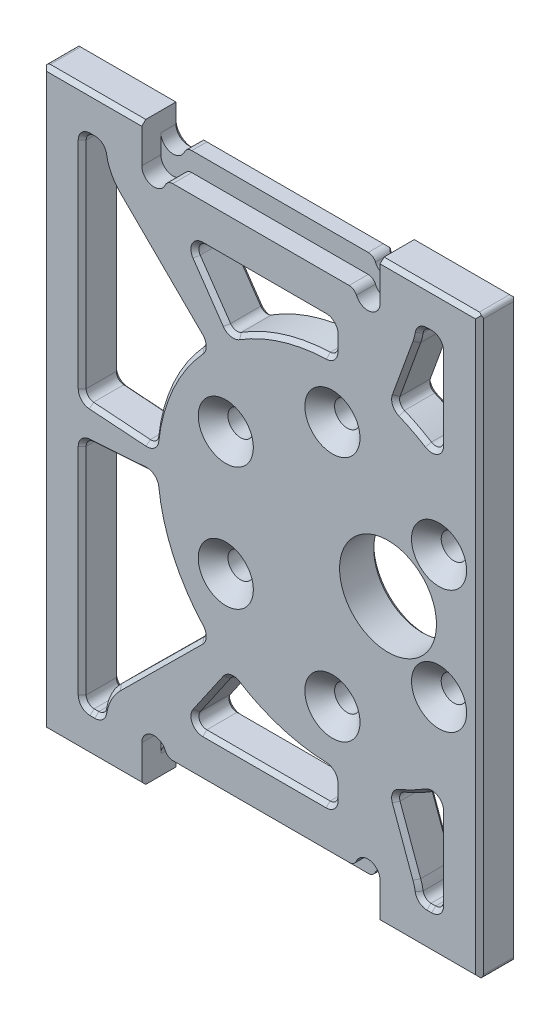
from build123d import *

# Parameters (mm, degrees)
SKETCH1_R           = 1.6
SKETCH1_R_2         = 6.1
BOSS_EXTRUDE1_DEPTH = 4.8
CHAMFER1_SIZE       = 1.87
CUT_EXTRUDE1_START  = -2.4
CUT_EXTRUDE1_DEPTH  = 2.4
CUT_EXTRUDE3_REACH  = 86.973
FILLET1_R           = 1
CUT_EXTRUDE2_DEPTH  = 0.5
CHAMFER2_SIZE       = 0.5
FILLET2_R           = 1
FILLET3_R           = 0.5


with BuildPart() as part:
    # Sketch1 → Boss-Extrude1 (new body)
    with BuildSketch(Plane.XY):
        with BuildLine():
            Line((23.817247353, 72.724765868), (0.017247353, 72.724765868))
            ThreePointArc((0.017247353, 72.724765868), (-1.532752647, 71.174765868), (-3.082752647, 72.724765868))
            Line((-3.082752647, 72.724765868), (-3.082752647, 75.124765868))
            Line((-3.082752647, 75.124765868), (-15.582752647, 75.124765868))
            Line((-15.582752647, 75.124765868), (-15.582752647, 2.624765868))
            Line((-15.582752647, 2.624765868), (-3.082752647, 2.624765868))
            Line((-3.082752647, 2.624765868), (-3.082752647, 5.024765868))
            ThreePointArc((-3.082752647, 5.024765868), (-1.532752647, 6.574765868), (0.017247353, 5.024765868))
            Line((0.017247353, 5.024765868), (23.817247353, 5.024765868))
            ThreePointArc((23.817247353, 5.024765868), (25.367247353, 6.574765868), (26.917247353, 5.024765868))
            Line((26.917247353, 5.024765868), (26.917247353, 2.624765868))
            Line((26.917247353, 2.624765868), (39.417247353, 2.624765868))
            Line((39.417247353, 2.624765868), (39.417247353, 75.124765868))
            Line((39.417247353, 75.124765868), (26.917247353, 75.124765868))
            Line((26.917247353, 75.124765868), (26.917247353, 72.724765868))
            ThreePointArc((26.917247353, 72.724765868), (25.367247353, 71.174765868), (23.817247353, 72.724765868))
        make_face()
        with Locations((20.917247353, 54.374765868)):
            Circle(SKETCH1_R, mode=Mode.SUBTRACT)
        with Locations((34.340641112, 46.624765868)):
            Circle(SKETCH1_R, mode=Mode.SUBTRACT)
        with Locations((34.340641112, 31.124765868)):
            Circle(SKETCH1_R, mode=Mode.SUBTRACT)
        with Locations((20.917247353, 23.374765868)):
            Circle(SKETCH1_R, mode=Mode.SUBTRACT)
        with Locations((7.493853595, 31.124765868)):
            Circle(SKETCH1_R, mode=Mode.SUBTRACT)
        with Locations((7.493853595, 46.624765868)):
            Circle(SKETCH1_R, mode=Mode.SUBTRACT)
        with Locations((27.917247353, 38.874765868)):
            Circle(SKETCH1_R_2, mode=Mode.SUBTRACT)
    extrude(amount=BOSS_EXTRUDE1_DEPTH)

    # Chamfer1
    chamfer1_edges = [part.edges().sort_by_distance(p)[0] for p in [
        (5.893853595, 31.124765868, 4.8),
        (19.317247353, 54.374765868, 4.8),
        (32.740641112, 46.624765868, 4.8),
        (32.740641112, 31.124765868, 4.8),
        (19.317247353, 23.374765868, 4.8),
        (5.893853595, 46.624765868, 4.8),
    ]]
    chamfer(chamfer1_edges, length=CHAMFER1_SIZE)

    # Sketch2 → Cut-Extrude1 (cut)
    with BuildSketch(Plane.XY.offset(4.8).offset(CUT_EXTRUDE1_START)):
        with BuildLine():
            Line((23.817247353, 72.724765868), (0.017247353, 72.724765868))
            ThreePointArc((0.017247353, 72.724765868), (-1.532752647, 71.174765868), (-3.082752647, 72.724765868))
            Line((-3.082752647, 72.724765868), (-3.082752647, 70.324765868))
            ThreePointArc((-3.082752647, 70.324765868), (-1.532752647, 68.774765868), (0.017247353, 70.324765868))
            Line((0.017247353, 70.324765868), (23.817247353, 70.324765868))
            ThreePointArc((23.817247353, 70.324765868), (25.367247353, 68.774765868), (26.917247353, 70.324765868))
            Line((26.917247353, 70.324765868), (26.917247353, 72.724765868))
            ThreePointArc((26.917247353, 72.724765868), (25.367247353, 71.174765868), (23.817247353, 72.724765868))
        make_face()
        with BuildLine():
            Line((26.917247353, 5.024765868), (26.917247353, 7.424765868))
            ThreePointArc((26.917247353, 7.424765868), (25.367247353, 8.974765868), (23.817247353, 7.424765868))
            Line((23.817247353, 7.424765868), (0.017247353, 7.424765868))
            ThreePointArc((0.017247353, 7.424765868), (-1.532752647, 8.974765868), (-3.082752647, 7.424765868))
            Line((-3.082752647, 7.424765868), (-3.082752647, 5.024765868))
            ThreePointArc((-3.082752647, 5.024765868), (-1.532752647, 6.574765868), (0.017247353, 5.024765868))
            Line((0.017247353, 5.024765868), (23.817247353, 5.024765868))
            ThreePointArc((23.817247353, 5.024765868), (25.367247353, 6.574765868), (26.917247353, 5.024765868))
        make_face()
    extrude(amount=CUT_EXTRUDE1_DEPTH, mode=Mode.SUBTRACT)

    # Sketch5 → Cut-Extrude3 (cut, up to next)
    with BuildSketch(Plane.XY.offset(4.8), mode=Mode.PRIVATE) as cut_extrude3_sk1:
        with BuildLine():
            Line((21.136112754, 65.324765868), (2.698381953, 65.324765868))
            Line((2.698381953, 65.324765868), (8.153946476, 57.404421848))
            ThreePointArc((8.153946476, 57.404421848), (14.322900612, 60.386729774), (21.103421377, 61.373995616))
            Line((21.103421377, 61.373995616), (21.136112754, 65.324765868))
        make_face()
    cut_extrude3_tool1 = extrude(cut_extrude3_sk1.sketch, amount=-CUT_EXTRUDE3_REACH, mode=Mode.PRIVATE) & part.part
    # Sketch5 → Cut-Extrude3 (cut, up to next)
    with BuildSketch(Plane.XY.offset(4.8), mode=Mode.PRIVATE) as cut_extrude3_sk2:
        with BuildLine():
            Line((-8.079698499, 70.124765868), (-10.582752647, 70.124765868))
            Line((-10.582752647, 70.124765868), (-10.582752647, 41.077460445))
            Line((-10.582752647, 41.077460445), (-1.527943777, 40.444286528))
            ThreePointArc((-1.527943777, 40.444286528), (0.420397988, 48.155345919), (4.929842745, 54.706787024))
            Line((4.929842745, 54.706787024), (-6.141629916, 65.670654749))
            ThreePointArc((-6.141629916, 65.670654749), (-7.538822397, 67.711410526), (-8.079698499, 70.124765868))
        make_face()
    cut_extrude3_tool2 = extrude(cut_extrude3_sk2.sketch, amount=-CUT_EXTRUDE3_REACH, mode=Mode.PRIVATE) & part.part
    # Sketch5 → Cut-Extrude3 (cut, up to next)
    with BuildSketch(Plane.XY.offset(4.8), mode=Mode.PRIVATE) as cut_extrude3_sk3:
        with BuildLine():
            Line((-10.582752647, 7.624765868), (-8.079698499, 7.624765868))
            ThreePointArc((-8.079698499, 7.624765868), (-7.538822397, 10.038121211), (-6.141629916, 12.078876988))
            Line((-6.141629916, 12.078876988), (4.929842745, 23.042744713))
            ThreePointArc((4.929842745, 23.042744713), (0.420397988, 29.594185818), (-1.527943777, 37.305245209))
            Line((-1.527943777, 37.305245209), (-10.582752647, 36.672071292))
            Line((-10.582752647, 36.672071292), (-10.582752647, 7.624765868))
        make_face()
    cut_extrude3_tool3 = extrude(cut_extrude3_sk3.sketch, amount=-CUT_EXTRUDE3_REACH, mode=Mode.PRIVATE) & part.part
    # Sketch5 → Cut-Extrude3 (cut, up to next)
    with BuildSketch(Plane.XY.offset(4.8), mode=Mode.PRIVATE) as cut_extrude3_sk4:
        with BuildLine():
            Line((2.698381953, 12.424765868), (21.136112754, 12.424765868))
            Line((21.136112754, 12.424765868), (21.103421377, 16.375536121))
            ThreePointArc((21.103421377, 16.375536121), (14.322900612, 17.362801963), (8.153946476, 20.345109889))
            Line((8.153946476, 20.345109889), (2.698381953, 12.424765868))
        make_face()
    cut_extrude3_tool4 = extrude(cut_extrude3_sk4.sketch, amount=-CUT_EXTRUDE3_REACH, mode=Mode.PRIVATE) & part.part
    # Sketch5 → Cut-Extrude3 (cut, up to next)
    with BuildSketch(Plane.XY.offset(4.8), mode=Mode.PRIVATE) as cut_extrude3_sk5:
        with BuildLine():
            Line((31.914193206, 7.624765868), (34.417247353, 7.624765868))
            Line((34.417247353, 7.624765868), (34.417247353, 20.874765868))
            ThreePointArc((34.417247353, 20.874765868), (31.622935196, 19.084913726), (28.595757122, 17.725522673))
            Line((28.595757122, 17.725522673), (31.524027039, 9.660065379))
            ThreePointArc((31.524027039, 9.660065379), (31.800113873, 8.657944013), (31.914193206, 7.624765868))
        make_face()
    cut_extrude3_tool5 = extrude(cut_extrude3_sk5.sketch, amount=-CUT_EXTRUDE3_REACH, mode=Mode.PRIVATE) & part.part
    # Sketch5 → Cut-Extrude3 (cut, up to next)
    with BuildSketch(Plane.XY.offset(4.8), mode=Mode.PRIVATE) as cut_extrude3_sk6:
        with BuildLine():
            Line((34.417247353, 70.124765868), (31.914193206, 70.124765868))
            ThreePointArc((31.914193206, 70.124765868), (31.800113873, 69.091587724), (31.524027039, 68.089466358))
            Line((31.524027039, 68.089466358), (28.595757122, 60.024009064))
            ThreePointArc((28.595757122, 60.024009064), (31.622935196, 58.664618011), (34.417247353, 56.874765868))
            Line((34.417247353, 56.874765868), (34.417247353, 70.124765868))
        make_face()
    cut_extrude3_tool6 = extrude(cut_extrude3_sk6.sketch, amount=-CUT_EXTRUDE3_REACH, mode=Mode.PRIVATE) & part.part
    add(cut_extrude3_tool1.solids().sort_by_distance((12.0119, 62.615113, 4.8))[0], mode=Mode.SUBTRACT)
    add(cut_extrude3_tool2.solids().sort_by_distance((-5.091163, 53.538363, 4.8))[0], mode=Mode.SUBTRACT)
    add(cut_extrude3_tool3.solids().sort_by_distance((-5.091163, 24.211169, 4.8))[0], mode=Mode.SUBTRACT)
    add(cut_extrude3_tool4.solids().sort_by_distance((12.0119, 15.134418, 4.8))[0], mode=Mode.SUBTRACT)
    add(cut_extrude3_tool5.solids().sort_by_distance((32.334052, 14.299107, 4.8))[0], mode=Mode.SUBTRACT)
    add(cut_extrude3_tool6.solids().sort_by_distance((32.334052, 63.450425, 4.8))[0], mode=Mode.SUBTRACT)

    # Fillet1
    fillet1_edges = [part.edges().sort_by_distance(p)[0] for p in [
        (31.914193206, 7.624765868, 2.4),
        (28.595757122, 17.725522673, 2.4),
        (34.417247353, 20.874765868, 2.4),
        (21.103421377, 16.375536121, 2.4),
        (8.153946476, 20.345109889, 2.4),
        (2.698381953, 12.424765868, 2.4),
        (34.417247353, 7.624765868, 2.4),
        (21.136112754, 12.424765868, 2.4),
        (-8.079698499, 7.624765868, 2.4),
        (4.929842745, 23.042744713, 2.4),
        (-1.527943777, 37.305245209, 2.4),
        (-10.582752647, 36.672071292, 2.4),
        (-10.582752647, 7.624765868, 2.4),
        (-10.582752647, 41.077460445, 2.4),
        (-8.079698499, 70.124765868, 2.4),
        (-10.582752647, 70.124765868, 2.4),
        (-1.527943777, 40.444286528, 2.4),
        (4.929842745, 54.706787024, 2.4),
        (21.103421377, 61.373995616, 2.4),
        (8.153946476, 57.404421848, 2.4),
        (2.698381953, 65.324765868, 2.4),
        (21.136112754, 65.324765868, 2.4),
        (28.595757122, 60.024009064, 2.4),
        (34.417247353, 56.874765868, 2.4),
        (34.417247353, 70.124765868, 2.4),
        (31.914193206, 70.124765868, 2.4),
    ]]
    fillet(fillet1_edges, radius=FILLET1_R)

    # Sketch3 → Cut-Extrude2 (cut)
    # profile 1 of 8: a face of its own
    with BuildSketch(Plane(origin=(0, 0, 0), x_dir=(-1, 0, 0), z_dir=(0, 0, -1))):
        with BuildLine():
            Line((-19.743526061, 9.734373512), (-19.070449138, 9.734373512))
            Line((-19.070449138, 9.734373512), (-19.070449138, 7.552482486))
            add(Edge.make_bspline(
                [(-19.070449138, 7.552482486), (-19.071258001, 7.500342239), (-19.072819947, 7.399657376), (-19.084734921, 7.253739002), (-19.104604675, 7.118464643), (-19.133196549, 6.993642719), (-19.17012433, 6.87973201), (-19.215288408, 6.776353819), (-19.267770501, 6.682953758), (-19.310922464, 6.62837786), (-19.331967567, 6.601761332)],
                knots=[0, 0, 0, 0, 1.243822755, 2.401870584, 3.490053692, 4.503076575, 5.453444971, 6.342269266, 7.191528908, 8, 8, 8, 8], degree=3))
            add(Edge.make_bspline(
                [(-19.331967567, 6.601761332), (-19.362188626, 6.568612277), (-19.422477741, 6.502481992), (-19.528770831, 6.419027913), (-19.645218827, 6.347701211), (-19.773010099, 6.28924556), (-19.911992435, 6.244721002), (-20.061808804, 6.212655385), (-20.222554182, 6.192683409), (-20.333576714, 6.190582135), (-20.390661477, 6.189501717)],
                knots=[0, 0, 0, 0, 0.916003385, 1.827369254, 2.751972866, 3.703651841, 4.69362366, 5.730423306, 6.83304546, 8, 8, 8, 8], degree=3))
            add(Edge.make_bspline(
                [(-20.390661477, 6.189501717), (-20.451003375, 6.190435882), (-20.567056381, 6.192232522), (-20.733822158, 6.209807785), (-20.885729712, 6.238726666), (-21.023492397, 6.279440352), (-21.148393677, 6.331972781), (-21.262788874, 6.394962196), (-21.366458296, 6.470271225), (-21.460968953, 6.554930919), (-21.544128966, 6.650800447), (-21.615139459, 6.757002058), (-21.675636707, 6.872558909), (-21.705507911, 6.955195276), (-21.720689522, 6.997194024)],
                knots=[0, 0, 0, 0, 1.29412125, 2.488928388, 3.592140377, 4.607309753, 5.564519828, 6.493640275, 7.402258018, 8.307438948, 9.210158992, 10.116782752, 11.042881838, 12, 12, 12, 12], degree=3))
            Line((-21.720689522, 6.997194024), (-21.022372215, 6.997194024))
            add(Edge.make_bspline(
                [(-21.022372215, 6.997194024), (-21.006234848, 6.979428322), (-20.97375504, 6.94367115), (-20.916307112, 6.898297721), (-20.852756682, 6.859460277), (-20.782591028, 6.82765867), (-20.705517591, 6.803476399), (-20.622061022, 6.785104367), (-20.5318475, 6.774750766), (-20.46968034, 6.773486638), (-20.437636638, 6.77283505)],
                knots=[0, 0, 0, 0, 0.888971165, 1.789239437, 2.70354581, 3.646217955, 4.638595249, 5.694475788, 6.811630907, 8, 8, 8, 8], degree=3))
            add(Edge.make_bspline(
                [(-20.437636638, 6.77283505), (-20.397141824, 6.773591673), (-20.319800278, 6.775036755), (-20.210379053, 6.790837164), (-20.112663753, 6.814442051), (-20.028064947, 6.849966829), (-19.955077437, 6.892636976), (-19.89418808, 6.9422039), (-19.84391118, 6.996800156), (-19.811024827, 7.048161894), (-19.791482532, 7.094755317), (-19.778175395, 7.134988068), (-19.768069812, 7.181363616), (-19.758871065, 7.233013978), (-19.751994852, 7.290604583), (-19.747439273, 7.354013425), (-19.743488903, 7.422961139), (-19.743513401, 7.470912155), (-19.743526061, 7.495691621)],
                knots=[0, 0, 0, 0, 1.656375485, 3.163532, 4.516250129, 5.759907703, 6.905105653, 7.965920022, 8.961443813, 9.932912751, 10.442911961, 11.026787936, 11.664959534, 12.383728702, 13.174001396, 14.037595414, 14.985895623, 16, 16, 16, 16], degree=3))
            add(Edge.make_bspline(
                [(-19.743526061, 7.495691621), (-19.771047536, 7.468698949), (-19.82475276, 7.416025631), (-19.911934799, 7.348825817), (-20.001181055, 7.293320425), (-20.093004411, 7.249196069), (-20.189231025, 7.216875757), (-20.290426071, 7.193663128), (-20.397742034, 7.179519303), (-20.471480943, 7.177640835), (-20.509151061, 7.176681204)],
                knots=[0, 0, 0, 0, 1.082007397, 2.111422008, 3.08419067, 4.02964304, 4.965866572, 5.929243163, 6.942137121, 8, 8, 8, 8], degree=3))
            add(Edge.make_bspline(
                [(-20.509151061, 7.176681204), (-20.550818595, 7.177643803), (-20.632668409, 7.179534689), (-20.752888942, 7.197910402), (-20.868229852, 7.22650122), (-20.979001719, 7.266302313), (-21.084074237, 7.319144085), (-21.184942628, 7.382011054), (-21.279737505, 7.458204315), (-21.369766676, 7.543470512), (-21.451137113, 7.63824762), (-21.522738064, 7.740038107), (-21.583099462, 7.848139823), (-21.632187138, 7.962452276), (-21.671297466, 8.082495587), (-21.698213698, 8.208919642), (-21.714661608, 8.341510981), (-21.716796274, 8.43187445), (-21.717885035, 8.477963255)],
                knots=[0, 0, 0, 0, 1.007560175, 1.979205489, 2.935124557, 3.879618859, 4.820364716, 5.775815361, 6.749909327, 7.75781854, 8.772289371, 9.766897274, 10.764314289, 11.762244114, 12.772609037, 13.814079916, 14.885097635, 16, 16, 16, 16], degree=3))
            add(Edge.make_bspline(
                [(-21.717885035, 8.477963255), (-21.71693411, 8.527100165), (-21.715075646, 8.623132131), (-21.696857395, 8.763399081), (-21.668508916, 8.89661395), (-21.628040716, 9.022498082), (-21.574874583, 9.140513329), (-21.510625439, 9.251034163), (-21.435899362, 9.355324434), (-21.376747429, 9.417193278), (-21.346991606, 9.448315819)],
                knots=[0, 0, 0, 0, 1.104124469, 2.157873671, 3.173961494, 4.162551312, 5.124378318, 6.07778831, 7.033049473, 8, 8, 8, 8], degree=3))
            add(Edge.make_bspline(
                [(-21.346991606, 9.448315819), (-21.318753758, 9.474853282), (-21.263109669, 9.527146678), (-21.172020469, 9.594247783), (-21.07768199, 9.651800485), (-20.978800276, 9.698095145), (-20.876075014, 9.734961678), (-20.768898061, 9.760752744), (-20.65780233, 9.77665492), (-20.582354816, 9.7783754), (-20.54420715, 9.779245306)],
                knots=[0, 0, 0, 0, 1.042068658, 2.053448347, 3.038272799, 4.011764631, 4.986555969, 5.970496305, 6.973845226, 8, 8, 8, 8], degree=3))
            add(Edge.make_bspline(
                [(-20.54420715, 9.779245306), (-20.508409884, 9.778240132), (-20.437475333, 9.776248314), (-20.332381147, 9.7621952), (-20.230615738, 9.737368333), (-20.131064843, 9.703236612), (-20.032673307, 9.659022853), (-19.935526153, 9.601072205), (-19.837653753, 9.531779608), (-19.775550296, 9.477637139), (-19.743526061, 9.449718063)],
                knots=[0, 0, 0, 0, 0.968122651, 1.918396369, 2.861262201, 3.796768263, 4.761417965, 5.77287463, 6.85156174, 8, 8, 8, 8], degree=3))
            Line((-19.743526061, 9.449718063), (-19.743526061, 9.734373512))
        make_face()
        with BuildLine():
            add(Edge.make_bspline(
                [(-20.394167086, 9.195911973), (-20.418726953, 9.195120571), (-20.467079001, 9.193562504), (-20.538141248, 9.184784201), (-20.605579648, 9.168214312), (-20.670216117, 9.146698891), (-20.731264789, 9.117756388), (-20.788843679, 9.082444217), (-20.84363528, 9.04145653), (-20.893896094, 8.994019877), (-20.940484422, 8.942763488), (-20.979601608, 8.88635291), (-21.014461994, 8.828000253), (-21.041571115, 8.765357435), (-21.063987981, 8.700124449), (-21.077688244, 8.630973837), (-21.088635177, 8.559169539), (-21.089327141, 8.510027367), (-21.089679907, 8.484974473)],
                knots=[0, 0, 0, 0, 1.059154978, 2.085203149, 3.079850876, 4.048488546, 5.017545358, 5.985239295, 6.956545898, 7.961752598, 8.960830395, 9.936516972, 10.916356752, 11.886198968, 12.873933111, 13.883774911, 14.921139228, 16, 16, 16, 16], degree=3))
            add(Edge.make_bspline(
                [(-21.089679907, 8.484974473), (-21.089298052, 8.458994273), (-21.088548614, 8.408004928), (-21.078055797, 8.333722978), (-21.063066963, 8.262630681), (-21.040425095, 8.195595848), (-21.012079566, 8.131737679), (-20.978030007, 8.071087553), (-20.935997728, 8.015095587), (-20.889322318, 7.962529561), (-20.837686702, 7.91500386), (-20.78210553, 7.873666712), (-20.723723115, 7.83796783), (-20.661277421, 7.810134039), (-20.596119579, 7.787579015), (-20.527596068, 7.77119956), (-20.455864359, 7.762349833), (-20.407043257, 7.760801105), (-20.382248016, 7.760014537)],
                knots=[0, 0, 0, 0, 1.097915424, 2.154794285, 3.166904039, 4.167166757, 5.140698173, 6.119085138, 7.101657521, 8.095747232, 9.089148684, 10.06378348, 11.021581144, 11.977080764, 12.949256321, 13.934658686, 14.951055324, 16, 16, 16, 16], degree=3))
            add(Edge.make_bspline(
                [(-20.382248016, 7.760014537), (-20.357902069, 7.760396262), (-20.310167364, 7.761144704), (-20.240535926, 7.771643883), (-20.174008816, 7.786824807), (-20.11070585, 7.808533565), (-20.050978343, 7.836868207), (-19.994024821, 7.870681304), (-19.941053382, 7.911599), (-19.891059411, 7.95785927), (-19.845943044, 8.009299466), (-19.806120395, 8.065034243), (-19.773407531, 8.125073666), (-19.745542863, 8.188467183), (-19.724911805, 8.256109033), (-19.709247054, 8.327327521), (-19.700058203, 8.402467663), (-19.699128286, 8.453866416), (-19.698654266, 8.480066621)],
                knots=[0, 0, 0, 0, 1.047368431, 2.053558439, 3.025081491, 3.983010266, 4.928381778, 5.867249904, 6.829345556, 7.804873619, 8.796055618, 9.770545002, 10.747991713, 11.735078325, 12.747239243, 13.787476531, 14.872179528, 16, 16, 16, 16], degree=3))
            add(Edge.make_bspline(
                [(-19.698654266, 8.480066621), (-19.699114152, 8.506035398), (-19.700012103, 8.556740739), (-19.709330714, 8.630926148), (-19.724859328, 8.701251303), (-19.74577616, 8.768296603), (-19.773035473, 8.831661667), (-19.807218532, 8.890756741), (-19.846308313, 8.94667304), (-19.892335173, 8.997505907), (-19.941945307, 9.044521548), (-19.996639242, 9.084295776), (-20.053681711, 9.119438848), (-20.114998684, 9.147299033), (-20.179828541, 9.169242431), (-20.248275405, 9.184252964), (-20.319990198, 9.194786073), (-20.369120331, 9.195531799), (-20.394167086, 9.195911973)],
                knots=[0, 0, 0, 0, 1.111098411, 2.169475416, 3.193737863, 4.190319778, 5.171520483, 6.139320596, 7.107999188, 8.085777416, 9.069626166, 10.027970922, 10.974971434, 11.932846196, 12.904000912, 13.89897495, 14.928888274, 16, 16, 16, 16], degree=3))
        make_face(mode=Mode.SUBTRACT)
    # profile 2 of 8: a face of its own
    with BuildSketch(Plane(origin=(0, 0, 0), x_dir=(-1, 0, 0), z_dir=(0, 0, -1))):
        with BuildLine():
            Line((-15.886655067, 8.298476076), (-17.903782471, 8.298476076))
            add(Edge.make_bspline(
                [(-17.903782471, 8.298476076), (-17.899669711, 8.2750382), (-17.891587813, 8.228980924), (-17.874037685, 8.162078735), (-17.85164109, 8.099031241), (-17.82480018, 8.039754163), (-17.793967495, 7.983934127), (-17.758003721, 7.93183295), (-17.717365028, 7.883496652), (-17.672286376, 7.839135307), (-17.623519146, 7.799386581), (-17.57129984, 7.764564184), (-17.515574572, 7.736011949), (-17.45698221, 7.711945377), (-17.395084935, 7.692882214), (-17.329791649, 7.679734713), (-17.261275436, 7.671968436), (-17.214600098, 7.670845133), (-17.190741606, 7.670270947)],
                knots=[0, 0, 0, 0, 1.091296461, 2.144483647, 3.168565212, 4.157007626, 5.126487748, 6.090021542, 7.05641414, 8.019231907, 8.98705074, 9.938580405, 10.892824166, 11.854447369, 12.841318655, 13.858982407, 14.905600794, 16, 16, 16, 16], degree=3))
            add(Edge.make_bspline(
                [(-17.190741606, 7.670270947), (-17.161942785, 7.671031264), (-17.105229427, 7.672528552), (-17.022143935, 7.685807267), (-16.941788162, 7.705864184), (-16.864922555, 7.735690502), (-16.790656748, 7.772819026), (-16.720213385, 7.819076597), (-16.652373144, 7.87311142), (-16.610982603, 7.91476144), (-16.589880227, 7.935996108)],
                knots=[0, 0, 0, 0, 1.021034703, 2.010718019, 2.977989445, 3.954245119, 4.929443971, 5.918328161, 6.938689359, 8, 8, 8, 8], degree=3))
            Line((-16.589880227, 7.935996108), (-16.064038881, 7.685695627))
            add(Edge.make_bspline(
                [(-16.064038881, 7.685695627), (-16.080594689, 7.662818041), (-16.113399414, 7.617486947), (-16.166952025, 7.553694389), (-16.222837586, 7.494173345), (-16.281097774, 7.439315293), (-16.341806479, 7.389276558), (-16.404794824, 7.343447576), (-16.470983357, 7.303058838), (-16.53904865, 7.266156361), (-16.61039774, 7.234520039), (-16.684833172, 7.2075417), (-16.76203967, 7.183153511), (-16.842992185, 7.164571047), (-16.927016626, 7.14986132), (-17.014313997, 7.139415465), (-17.104872791, 7.132963561), (-17.166425076, 7.132198696), (-17.197752824, 7.131809409)],
                knots=[0, 0, 0, 0, 1.028154879, 2.037251081, 3.030720504, 4.000128189, 4.949298328, 5.894184978, 6.834267904, 7.770992897, 8.712077017, 9.673380525, 10.653304757, 11.658697181, 12.695551717, 13.758623199, 14.859225354, 16, 16, 16, 16], degree=3))
            add(Edge.make_bspline(
                [(-17.197752824, 7.131809409), (-17.245950048, 7.132792005), (-17.340341536, 7.134716364), (-17.478406149, 7.152577164), (-17.609529238, 7.182192297), (-17.734081049, 7.22244952), (-17.851523185, 7.275601668), (-17.961913769, 7.340611153), (-18.066355761, 7.416231614), (-18.161657875, 7.504050124), (-18.248480913, 7.59963535), (-18.324740871, 7.702287357), (-18.388554118, 7.811288952), (-18.44095884, 7.92591874), (-18.48168961, 8.04647013), (-18.511054133, 8.172995726), (-18.529054937, 8.305435098), (-18.530999113, 8.395641095), (-18.531987599, 8.441504922)],
                knots=[0, 0, 0, 0, 1.103565453, 2.161269334, 3.182010356, 4.179077853, 5.15417608, 6.128274628, 7.109042802, 8.101804412, 9.090965879, 10.063106201, 11.02526161, 11.978650795, 12.945248442, 13.93468508, 14.949922959, 16, 16, 16, 16], degree=3))
            add(Edge.make_bspline(
                [(-18.531987599, 8.441504922), (-18.530989384, 8.488534207), (-18.529025442, 8.581062215), (-18.511209119, 8.716559673), (-18.481608427, 8.845842574), (-18.44075851, 8.969088956), (-18.389148775, 9.08668428), (-18.324523614, 9.197599727), (-18.248518757, 9.302221445), (-18.162008497, 9.400060003), (-18.066302654, 9.48836999), (-17.964606153, 9.567071837), (-17.855776331, 9.63265144), (-17.741044146, 9.685639719), (-17.621143467, 9.728691357), (-17.49468841, 9.757338627), (-17.362641104, 9.776573554), (-17.272376473, 9.778344971), (-17.226498817, 9.779245306)],
                knots=[0, 0, 0, 0, 1.079208495, 2.12329425, 3.130605359, 4.119693003, 5.099659317, 6.073216462, 7.060498243, 8.06384408, 9.066070512, 10.045757761, 11.010926815, 11.975797609, 12.942977511, 13.929384301, 14.947594487, 16, 16, 16, 16], degree=3))
            add(Edge.make_bspline(
                [(-17.226498817, 9.779245306), (-17.178070695, 9.778247466), (-17.082987068, 9.776288308), (-16.943960877, 9.758572534), (-16.811967146, 9.728776812), (-16.686443509, 9.688867685), (-16.568992953, 9.634372858), (-16.457034733, 9.570963153), (-16.353254243, 9.493708099), (-16.256545294, 9.406319345), (-16.169245702, 9.309364551), (-16.092936186, 9.204041949), (-16.028006179, 9.091379427), (-15.975379765, 8.970920114), (-15.934690817, 8.84302564), (-15.905299113, 8.707862101), (-15.887435611, 8.564915401), (-15.885527612, 8.467031603), (-15.884551702, 8.416965659)],
                knots=[0, 0, 0, 0, 1.080001299, 2.120471247, 3.119684163, 4.095710327, 5.052285597, 6.002875087, 6.961153713, 7.931888285, 8.906493152, 9.865905668, 10.82813294, 11.801621613, 12.7925306, 13.817193356, 14.883530496, 16, 16, 16, 16], degree=3))
            Line((-15.884551702, 8.416965659), (-15.886655067, 8.298476076))
        make_face()
        with BuildLine():
            add(Edge.make_bspline(
                [(-16.51275683, 8.792065819), (-16.524611445, 8.824056623), (-16.548181508, 8.887662675), (-16.601425298, 8.975423506), (-16.672078105, 9.05142795), (-16.754252388, 9.118715287), (-16.848141652, 9.173329892), (-16.950787281, 9.212872641), (-17.060891855, 9.236582969), (-17.136637869, 9.239363774), (-17.175316926, 9.240783768)],
                knots=[0, 0, 0, 0, 0.954238005, 1.897273737, 2.851915805, 3.847685534, 4.862635127, 5.880135777, 6.917509367, 8, 8, 8, 8], degree=3))
            add(Edge.make_bspline(
                [(-17.175316926, 9.240783768), (-17.217560755, 9.23941969), (-17.300138643, 9.236753203), (-17.419251625, 9.20839413), (-17.53160792, 9.166069061), (-17.597846823, 9.122431015), (-17.631046093, 9.100559409)],
                knots=[0, 0, 0, 0, 1.044195649, 2.041185066, 3.018232172, 4, 4, 4, 4], degree=3))
            add(Edge.make_bspline(
                [(-17.631046093, 9.100559409), (-17.651759957, 9.083901515), (-17.695920858, 9.048387735), (-17.753272746, 8.977541117), (-17.809764833, 8.891761767), (-17.8418837, 8.82660629), (-17.858910676, 8.792065819)],
                knots=[0, 0, 0, 0, 0.82159062, 1.751589201, 2.808063854, 4, 4, 4, 4], degree=3))
            Line((-17.858910676, 8.792065819), (-16.51275683, 8.792065819))
        make_face(mode=Mode.SUBTRACT)
    # profile 3 of 8: a face of its own
    with BuildSketch(Plane(origin=(0, 0, 0), x_dir=(-1, 0, 0), z_dir=(0, 0, -1))):
        with BuildLine():
            Line((-15.346090163, 9.734373512), (-14.717885035, 9.734373512))
            Line((-14.717885035, 9.734373512), (-14.717885035, 9.463740499))
            add(Edge.make_bspline(
                [(-14.717885035, 9.463740499), (-14.682046244, 9.491616649), (-14.613551347, 9.54489339), (-14.509427278, 9.612821507), (-14.411147048, 9.668417943), (-14.316519886, 9.710707437), (-14.22376538, 9.74113291), (-14.131381302, 9.762991797), (-14.037991869, 9.776988643), (-13.975211501, 9.778493489), (-13.943846574, 9.779245306)],
                knots=[0, 0, 0, 0, 1.276643801, 2.439914479, 3.493451431, 4.44993799, 5.350072675, 6.235028322, 7.118224225, 8, 8, 8, 8], degree=3))
            add(Edge.make_bspline(
                [(-13.943846574, 9.779245306), (-13.912031076, 9.778386135), (-13.849574582, 9.776699508), (-13.757610836, 9.764902923), (-13.669748408, 9.743417604), (-13.584999357, 9.714890911), (-13.504226283, 9.677237313), (-13.426439668, 9.632529774), (-13.35331034, 9.578072967), (-13.308274062, 9.536601277), (-13.285493208, 9.515623512)],
                knots=[0, 0, 0, 0, 1.048836932, 2.058954983, 3.049370783, 4.026390553, 5.001981509, 5.982488534, 6.97947532, 8, 8, 8, 8], degree=3))
            add(Edge.make_bspline(
                [(-13.285493208, 9.515623512), (-13.267222125, 9.496183257), (-13.230546236, 9.457160469), (-13.184394238, 9.390382483), (-13.144790633, 9.317582256), (-13.112340981, 9.237920012), (-13.088361996, 9.150958061), (-13.069914635, 9.057746778), (-13.0595635, 8.957764248), (-13.058285603, 8.889077194), (-13.057628625, 8.853764537)],
                knots=[0, 0, 0, 0, 0.889584746, 1.785680191, 2.700364693, 3.65222533, 4.649950538, 5.707241244, 6.821271309, 8, 8, 8, 8], degree=3))
            Line((-13.057628625, 8.853764537), (-13.057628625, 7.176681204))
            Line((-13.057628625, 7.176681204), (-13.685833753, 7.176681204))
            Line((-13.685833753, 7.176681204), (-13.685833753, 8.287258127))
            add(Edge.make_bspline(
                [(-13.685833753, 8.287258127), (-13.685966605, 8.323483211), (-13.68622119, 8.392901862), (-13.688175841, 8.492250384), (-13.69199246, 8.581975001), (-13.695471208, 8.662239076), (-13.702301374, 8.732757617), (-13.708460928, 8.79397706), (-13.717912166, 8.845342019), (-13.730209761, 8.900592739), (-13.751684389, 8.959748738), (-13.785022703, 9.022079357), (-13.827317029, 9.075030606), (-13.876839899, 9.118973702), (-13.933536617, 9.153736722), (-13.996722087, 9.178194671), (-14.06605756, 9.193437466), (-14.114369703, 9.195066151), (-14.139459554, 9.195911973)],
                knots=[0, 0, 0, 0, 1.49886392, 2.872294502, 4.110984203, 5.214877267, 6.195405875, 7.042225351, 7.75923308, 8.355011229, 9.382752534, 10.352059385, 11.267231453, 12.171456522, 13.078624015, 14.003401117, 14.963110155, 16, 16, 16, 16], degree=3))
            add(Edge.make_bspline(
                [(-14.139459554, 9.195911973), (-14.172089962, 9.194257276), (-14.235921382, 9.191020368), (-14.328240763, 9.166611125), (-14.413034575, 9.125098189), (-14.489609985, 9.067652632), (-14.557237674, 8.996728975), (-14.612937634, 8.912144377), (-14.658623044, 8.815940283), (-14.678268449, 8.745695668), (-14.68843792, 8.709333447)],
                knots=[0, 0, 0, 0, 0.984188326, 1.925263693, 2.85911992, 3.81709677, 4.80007086, 5.801799564, 6.862098548, 8, 8, 8, 8], degree=3))
            add(Edge.make_bspline(
                [(-14.68843792, 8.709333447), (-14.690965437, 8.697913648), (-14.696602309, 8.672445201), (-14.701237924, 8.629419042), (-14.7076864, 8.57837267), (-14.710102485, 8.51838229), (-14.714303792, 8.449731811), (-14.715857636, 8.37233041), (-14.71741426, 8.286329858), (-14.717722911, 8.22626174), (-14.717885035, 8.19471005)],
                knots=[0, 0, 0, 0, 0.543362196, 1.211806945, 2.009705693, 2.934833164, 4.000995085, 5.207458376, 6.533175157, 8, 8, 8, 8], degree=3))
            Line((-14.717885035, 8.19471005), (-14.717885035, 7.176681204))
            Line((-14.717885035, 7.176681204), (-15.346090163, 7.176681204))
            Line((-15.346090163, 7.176681204), (-15.346090163, 9.734373512))
        make_face()
    # profile 4 of 8: a face of its own
    with BuildSketch(Plane(origin=(0, 0, 0), x_dir=(-1, 0, 0), z_dir=(0, 0, -1))):
        with BuildLine():
            Line((-11.801218368, 9.824117101), (-12.429423497, 9.824117101))
            add(Edge.make_bspline(
                [(-12.429423497, 9.824117101), (-12.42498813, 9.855518835), (-12.416292886, 9.917079853), (-12.395486331, 10.006204871), (-12.370599447, 10.09074605), (-12.339529443, 10.170435666), (-12.303089383, 10.245415672), (-12.261649822, 10.315943363), (-12.214762782, 10.38171602), (-12.178823369, 10.42133773), (-12.160893849, 10.441104281)],
                knots=[0, 0, 0, 0, 1.111473889, 2.178970933, 3.205615836, 4.199322666, 5.174200091, 6.12565194, 7.064921805, 8, 8, 8, 8], degree=3))
            add(Edge.make_bspline(
                [(-12.160893849, 10.441104281), (-12.135032892, 10.467184813), (-12.084063664, 10.518586801), (-11.998888106, 10.584427069), (-11.909608391, 10.641407344), (-11.814433976, 10.686581717), (-11.714845845, 10.72314514), (-11.610052041, 10.747704873), (-11.500480787, 10.764000473), (-11.425712191, 10.765605646), (-11.387556509, 10.766424794)],
                knots=[0, 0, 0, 0, 1.01925491, 2.00884431, 2.983262333, 3.955970413, 4.92937149, 5.924503185, 6.940838805, 8, 8, 8, 8], degree=3))
            add(Edge.make_bspline(
                [(-11.387556509, 10.766424794), (-11.353634145, 10.765623953), (-11.286949613, 10.764049662), (-11.188940129, 10.751412107), (-11.095496288, 10.729247243), (-11.005630362, 10.70026718), (-10.920663985, 10.660834962), (-10.838721868, 10.615062549), (-10.762093475, 10.558920783), (-10.69059951, 10.495486237), (-10.624918668, 10.426875566), (-10.568038772, 10.353536401), (-10.519138104, 10.2774278), (-10.478850421, 10.197917445), (-10.447874668, 10.114870794), (-10.426376577, 10.028767598), (-10.412305555, 9.939797848), (-10.410903713, 9.879326308), (-10.410192727, 9.848656364)],
                knots=[0, 0, 0, 0, 1.091422571, 2.145516843, 3.172569842, 4.178562979, 5.178154469, 6.181868002, 7.194278174, 8.227918432, 9.254613415, 10.245994977, 11.209837596, 12.161663635, 13.10878368, 14.055455738, 15.013766427, 16, 16, 16, 16], degree=3))
            add(Edge.make_bspline(
                [(-10.410192727, 9.848656364), (-10.411651713, 9.810674193), (-10.414524006, 9.735898975), (-10.438093251, 9.626459887), (-10.474985529, 9.521816589), (-10.528280013, 9.423433199), (-10.594911692, 9.331577459), (-10.676666531, 9.249320383), (-10.771215939, 9.175372292), (-10.842195439, 9.135632579), (-10.878542086, 9.115282967)],
                knots=[0, 0, 0, 0, 0.992805628, 1.954529043, 2.915727527, 3.886831945, 4.871318353, 5.87440735, 6.911542536, 8, 8, 8, 8], degree=3))
            add(Edge.make_bspline(
                [(-10.878542086, 9.115282967), (-10.853594305, 9.107092085), (-10.804573034, 9.090997369), (-10.734895191, 9.059299009), (-10.668639525, 9.024657956), (-10.606946933, 8.984414184), (-10.549203809, 8.940194972), (-10.495762162, 8.89162232), (-10.44630269, 8.838802138), (-10.401632798, 8.781443934), (-10.361986524, 8.720465043), (-10.326414034, 8.65727404), (-10.297135891, 8.590912622), (-10.272333659, 8.522138681), (-10.253450652, 8.450334114), (-10.240155327, 8.375777156), (-10.232470304, 8.298637879), (-10.231298206, 8.246376065), (-10.230705548, 8.219950435)],
                knots=[0, 0, 0, 0, 1.059543567, 2.081955587, 3.086750234, 4.076226789, 5.052108497, 6.020845489, 6.989030705, 7.970690546, 8.952259656, 9.923888338, 10.895517021, 11.877585046, 12.873342345, 13.889638361, 14.932918083, 16, 16, 16, 16], degree=3))
            add(Edge.make_bspline(
                [(-10.230705548, 8.219950435), (-10.231906946, 8.181115487), (-10.234275859, 8.10454088), (-10.249336299, 7.99175432), (-10.277376124, 7.884222356), (-10.314264067, 7.78070767), (-10.36346858, 7.682546598), (-10.421374019, 7.58748648), (-10.492551439, 7.498823972), (-10.571652919, 7.414215068), (-10.659499724, 7.337292441), (-10.754739952, 7.270603986), (-10.855279352, 7.213373425), (-10.961754008, 7.166912026), (-11.074126929, 7.131131434), (-11.192147645, 7.105267573), (-11.316312047, 7.089443635), (-11.401063965, 7.087784795), (-11.444347375, 7.086937614)],
                knots=[0, 0, 0, 0, 1.005138573, 1.981928558, 2.936866704, 3.876260664, 4.820238198, 5.773547, 6.751179199, 7.756627054, 8.768222608, 9.766606018, 10.760583154, 11.757261445, 12.767156078, 13.807575856, 14.880313354, 16, 16, 16, 16], degree=3))
            add(Edge.make_bspline(
                [(-11.444347375, 7.086937614), (-11.485292782, 7.087830824), (-11.565356107, 7.089577377), (-11.682465477, 7.104694678), (-11.793766848, 7.129080111), (-11.899544263, 7.163453402), (-11.999388477, 7.208029686), (-12.094204918, 7.261110038), (-12.182101542, 7.32575601), (-12.264057693, 7.39904936), (-12.338255336, 7.481280338), (-12.404570555, 7.570544103), (-12.461541088, 7.667180088), (-12.509400573, 7.770775426), (-12.547774857, 7.881511852), (-12.578044379, 7.99916418), (-12.599188136, 8.123962264), (-12.605627512, 8.209826001), (-12.608910676, 8.253604281)],
                knots=[0, 0, 0, 0, 1.066544725, 2.085487077, 3.070979577, 4.031932826, 4.977951092, 5.916076795, 6.857635327, 7.814973522, 8.776389752, 9.738577119, 10.707772778, 11.69409279, 12.707140348, 13.757286496, 14.856535458, 16, 16, 16, 16], degree=3))
            Line((-12.608910676, 8.253604281), (-11.980705548, 8.253604281))
            add(Edge.make_bspline(
                [(-11.980705548, 8.253604281), (-11.976724678, 8.231591987), (-11.968970888, 8.188717273), (-11.953847598, 8.126644217), (-11.934139842, 8.069346953), (-11.911352772, 8.016316224), (-11.886739305, 7.966855754), (-11.857000352, 7.922792242), (-11.824315026, 7.882929182), (-11.777149862, 7.835539537), (-11.709724012, 7.786848656), (-11.618676777, 7.744533963), (-11.51739535, 7.719732354), (-11.446589531, 7.716706634), (-11.409992407, 7.715142742)],
                knots=[0, 0, 0, 0, 0.928156231, 1.807827665, 2.648129825, 3.438902246, 4.202261636, 4.936546065, 5.639352463, 6.338805438, 7.70633318, 9.064371875, 10.482673459, 12, 12, 12, 12], degree=3))
            add(Edge.make_bspline(
                [(-11.409992407, 7.715142742), (-11.390572679, 7.715475758), (-11.352533777, 7.716128062), (-11.296660294, 7.723357979), (-11.243432934, 7.735265656), (-11.192752558, 7.751447749), (-11.144296534, 7.771733013), (-11.09899066, 7.797889648), (-11.05591149, 7.82830047), (-11.015527335, 7.862490308), (-10.978211543, 7.899744991), (-10.947162609, 7.940998224), (-10.918786131, 7.982918882), (-10.897798683, 8.028249562), (-10.879409157, 8.074550989), (-10.868153828, 8.12350376), (-10.859655246, 8.174080978), (-10.859161342, 8.208693805), (-10.858910676, 8.226260531)],
                knots=[0, 0, 0, 0, 1.110435564, 2.175094844, 3.216326037, 4.226890168, 5.215276772, 6.21526065, 7.213097102, 8.228249917, 9.239874822, 10.221364777, 11.178138315, 12.128914389, 13.072518965, 14.022636769, 14.996447288, 16, 16, 16, 16], degree=3))
            add(Edge.make_bspline(
                [(-10.858910676, 8.226260531), (-10.859576148, 8.245472738), (-10.86090095, 8.28371984), (-10.871724722, 8.339533444), (-10.888817745, 8.393221632), (-10.912562041, 8.444546648), (-10.944269903, 8.493319319), (-10.981684827, 8.540518172), (-11.027754489, 8.58368659), (-11.078299078, 8.626357263), (-11.136910945, 8.663553221), (-11.20073561, 8.697879625), (-11.271450484, 8.725192844), (-11.347329353, 8.749588609), (-11.429807538, 8.767406896), (-11.518372879, 8.78034471), (-11.612882508, 8.789974906), (-11.678029223, 8.791356517), (-11.711474779, 8.792065819)],
                knots=[0, 0, 0, 0, 0.809814727, 1.612155564, 2.388397, 3.182215007, 3.988903953, 4.837162975, 5.715530372, 6.646997145, 7.623086902, 8.637258368, 9.698941581, 10.815059213, 11.996518529, 13.252603015, 14.589518788, 16, 16, 16, 16], degree=3))
            Line((-11.711474779, 8.792065819), (-11.711474779, 9.375399153))
            add(Edge.make_bspline(
                [(-11.711474779, 9.375399153), (-11.669833073, 9.378945493), (-11.591929689, 9.385579995), (-11.483795614, 9.401095007), (-11.392760662, 9.421833376), (-11.316636806, 9.446853095), (-11.253428434, 9.478984933), (-11.198209949, 9.514457062), (-11.150653178, 9.555652757), (-11.110461327, 9.601343567), (-11.078309096, 9.650411212), (-11.055553621, 9.702093035), (-11.040527094, 9.754789938), (-11.039103331, 9.790833032), (-11.038397856, 9.808692422)],
                knots=[0, 0, 0, 0, 1.70044513, 3.18119609, 4.440695891, 5.496282586, 6.431922213, 7.318171381, 8.16090191, 8.983045123, 9.787564368, 10.536848927, 11.275007137, 12, 12, 12, 12], degree=3))
            add(Edge.make_bspline(
                [(-11.038397856, 9.808692422), (-11.039615003, 9.831479064), (-11.041990617, 9.875953766), (-11.060440925, 9.939606433), (-11.092468567, 9.99634751), (-11.135412013, 10.046057598), (-11.187740094, 10.087579189), (-11.249077778, 10.117723156), (-11.318094034, 10.135434082), (-11.366650689, 10.137270109), (-11.39176324, 10.138219665)],
                knots=[0, 0, 0, 0, 1.009664648, 1.970651636, 2.907870547, 3.878035693, 4.867062054, 5.849714035, 6.887914197, 8, 8, 8, 8], degree=3))
            add(Edge.make_bspline(
                [(-11.39176324, 10.138219665), (-11.414524944, 10.137099288), (-11.459691137, 10.134876117), (-11.52573763, 10.118282953), (-11.588459793, 10.090350426), (-11.646558829, 10.051833118), (-11.699196065, 10.005575464), (-11.74239605, 9.950792874), (-11.778327748, 9.890767469), (-11.793558249, 9.846420986), (-11.801218368, 9.824117101)],
                knots=[0, 0, 0, 0, 0.98818071, 1.960853194, 2.938124878, 3.957524365, 4.978590984, 5.968022688, 6.978025184, 8, 8, 8, 8], degree=3))
        make_face()
    # profile 5 of 8: a face of its own
    with BuildSketch(Plane(origin=(0, 0, 0), x_dir=(-1, 0, 0), z_dir=(0, 0, -1))):
        with BuildLine():
            add(Edge.make_bspline(
                [(-9.400577343, 7.894629922), (-9.375217447, 7.8932395), (-9.325288191, 7.890501998), (-9.253147224, 7.870072314), (-9.188039586, 7.833367475), (-9.129824659, 7.785492374), (-9.080599582, 7.727892236), (-9.045020809, 7.662206321), (-9.022865015, 7.590343324), (-9.020419, 7.540256984), (-9.019167086, 7.514621909)],
                knots=[0, 0, 0, 0, 1.016957001, 2.002212695, 2.9757545, 3.99499976, 5.013036768, 5.994806404, 6.97370641, 8, 8, 8, 8], degree=3))
            add(Edge.make_bspline(
                [(-9.019167086, 7.514621909), (-9.020410799, 7.488982717), (-9.02284079, 7.438888333), (-9.045174125, 7.366885305), (-9.080546416, 7.300659512), (-9.129828608, 7.242442151), (-9.187798498, 7.193664799), (-9.253296918, 7.157298432), (-9.325150764, 7.135709824), (-9.375193258, 7.133122056), (-9.400577343, 7.131809409)],
                knots=[0, 0, 0, 0, 1.023218912, 1.999186227, 2.986238111, 4.008388923, 5.030539734, 6.0011649, 6.986089706, 8, 8, 8, 8], degree=3))
            add(Edge.make_bspline(
                [(-9.400577343, 7.131809409), (-9.425967442, 7.133111382), (-9.476021794, 7.135678107), (-9.547987332, 7.157480403), (-9.613969312, 7.193422003), (-9.671953767, 7.242501317), (-9.72145613, 7.300453359), (-9.755822754, 7.36709426), (-9.778364117, 7.438861187), (-9.780760889, 7.488973526), (-9.781987599, 7.514621909)],
                knots=[0, 0, 0, 0, 1.013427518, 1.99788335, 2.976245624, 3.997909735, 5.019573847, 6.001765691, 6.977268297, 8, 8, 8, 8], degree=3))
            add(Edge.make_bspline(
                [(-9.781987599, 7.514621909), (-9.780752796, 7.540266334), (-9.778340212, 7.590370942), (-9.755975633, 7.66199496), (-9.721401052, 7.728099509), (-9.671957895, 7.785433085), (-9.613726982, 7.833608376), (-9.548137865, 7.869892837), (-9.475884436, 7.89053395), (-9.425943282, 7.893250262), (-9.400577343, 7.894629922)],
                knots=[0, 0, 0, 0, 1.025808215, 2.00424526, 2.981110158, 3.998665696, 5.017428914, 5.998734231, 6.983523959, 8, 8, 8, 8], degree=3))
        make_face()
    # profile 6 of 8: a face of its own
    with BuildSketch(Plane(origin=(0, 0, 0), x_dir=(-1, 0, 0), z_dir=(0, 0, -1))):
        with BuildLine():
            add(Edge.make_bspline(
                [(-7.3918634, 10.766424794), (-7.361455665, 10.765973382), (-7.301665932, 10.765085787), (-7.213606911, 10.755472405), (-7.128781727, 10.740949267), (-7.046858533, 10.720694553), (-6.96842702, 10.693888161), (-6.892916349, 10.661801369), (-6.821225314, 10.622751159), (-6.752439627, 10.578641942), (-6.686585782, 10.528704054), (-6.625246531, 10.471772284), (-6.56730169, 10.409156634), (-6.51400555, 10.339910467), (-6.464177853, 10.264663651), (-6.417982323, 10.183404253), (-6.375772599, 10.095734565), (-6.337075611, 10.001496378), (-6.302472642, 9.899277103), (-6.273326605, 9.787904241), (-6.248329, 9.667352357), (-6.227229258, 9.53732138), (-6.211281264, 9.397638468), (-6.200531994, 9.248396418), (-6.193155337, 9.089882948), (-6.192553305, 8.98114401), (-6.192244009, 8.92527896)],
                knots=[0, 0, 0, 0, 0.879237366, 1.728815576, 2.559023295, 3.367336655, 4.166867292, 4.954216142, 5.737608147, 6.525189134, 7.316157332, 8.124696809, 8.942788509, 9.781158001, 10.649253743, 11.551476218, 12.482711956, 13.461909668, 14.496590415, 15.601789533, 16.789733467, 18.056700938, 19.410929216, 20.8549011, 22.384193279, 24, 24, 24, 24], degree=3))
            add(Edge.make_bspline(
                [(-6.192244009, 8.92527896), (-6.192578275, 8.868714976), (-6.193227746, 8.758812169), (-6.200225344, 8.598848854), (-6.212275539, 8.448523218), (-6.227806699, 8.307850812), (-6.249080141, 8.176905923), (-6.273994298, 8.055349493), (-6.303600397, 7.943225581), (-6.339343176, 7.840786829), (-6.377805931, 7.746383139), (-6.420131116, 7.658884385), (-6.465581011, 7.578053573), (-6.513113131, 7.502671259), (-6.565333362, 7.434959675), (-6.619699999, 7.372616275), (-6.678580261, 7.318015797), (-6.739495063, 7.268344379), (-6.804675959, 7.225418306), (-6.873450757, 7.18787587), (-6.947045591, 7.157424495), (-7.024118953, 7.130939516), (-7.105984574, 7.111926158), (-7.19134162, 7.096839684), (-7.281153756, 7.088501973), (-7.342301475, 7.087467625), (-7.373634234, 7.086937614)],
                knots=[0, 0, 0, 0, 1.643780988, 3.193836972, 4.651895693, 6.025988579, 7.305620092, 8.505800249, 9.631074763, 10.672816429, 11.65661981, 12.592235626, 13.49536222, 14.350718032, 15.179365177, 15.97804903, 16.751647189, 17.51006938, 18.259804725, 19.016521909, 19.783502495, 20.571750527, 21.382245291, 22.22305063, 23.089471752, 24, 24, 24, 24], degree=3))
            add(Edge.make_bspline(
                [(-7.373634234, 7.086937614), (-7.404966147, 7.087477849), (-7.466344903, 7.088536161), (-7.5563999, 7.09677769), (-7.642209296, 7.111987274), (-7.724722605, 7.131085486), (-7.803365549, 7.157365894), (-7.878515217, 7.188728352), (-7.949593774, 7.226036542), (-8.016798025, 7.269062629), (-8.079898515, 7.318401708), (-8.139875827, 7.373526042), (-8.196597286, 7.434295905), (-8.249200018, 7.501391969), (-8.298545505, 7.573918643), (-8.344119151, 7.652704145), (-8.385893566, 7.737633765), (-8.425175463, 7.828825888), (-8.459306459, 7.928243774), (-8.489681461, 8.036775213), (-8.514563864, 8.155324904), (-8.534575957, 8.283854761), (-8.5505536, 8.422092489), (-8.562439131, 8.57010481), (-8.569475597, 8.727960666), (-8.570118258, 8.836462858), (-8.570449138, 8.892326236)],
                knots=[0, 0, 0, 0, 0.917216111, 1.796812873, 2.643793957, 3.46689424, 4.273913431, 5.068098542, 5.848489301, 6.620921603, 7.401012384, 8.190319798, 9.003608147, 9.831726257, 10.68377682, 11.569763213, 12.493818149, 13.453288342, 14.474581811, 15.568529029, 16.750744269, 18.018426408, 19.375425659, 20.823733699, 22.36466933, 24, 24, 24, 24], degree=3))
            add(Edge.make_bspline(
                [(-8.570449138, 8.892326236), (-8.56984978, 8.969944001), (-8.568693311, 9.119708479), (-8.554037691, 9.336074606), (-8.532526957, 9.53606761), (-8.500932785, 9.719352952), (-8.461867028, 9.886609469), (-8.411841292, 10.03673536), (-8.354890631, 10.171807956), (-8.306361351, 10.251825775), (-8.282989202, 10.290363095)],
                knots=[0, 0, 0, 0, 1.288568992, 2.486310467, 3.599230591, 4.627010532, 5.572937695, 6.447898582, 7.252493626, 8, 8, 8, 8], degree=3))
            add(Edge.make_bspline(
                [(-8.282989202, 10.290363095), (-8.25581318, 10.328222146), (-8.202678702, 10.402244052), (-8.109771582, 10.499420978), (-8.009954978, 10.582531443), (-7.901178714, 10.649694584), (-7.785163132, 10.702659442), (-7.660912178, 10.740067925), (-7.528884692, 10.761863851), (-7.438219214, 10.764881776), (-7.3918634, 10.766424794)],
                knots=[0, 0, 0, 0, 1.058512271, 2.069600068, 3.047294572, 4.004278952, 4.967380941, 5.939006123, 6.946246673, 8, 8, 8, 8], degree=3))
        make_face()
        with BuildLine():
            add(Edge.make_bspline(
                [(-7.376438721, 10.138219665), (-7.403927566, 10.136916749), (-7.457820294, 10.134362341), (-7.536021211, 10.112679019), (-7.609759793, 10.07918796), (-7.665850763, 10.038886706), (-7.707834296, 10.000253122), (-7.737168491, 9.965290985), (-7.765456699, 9.926275759), (-7.790442269, 9.881446889), (-7.81403517, 9.832415128), (-7.837092545, 9.778957902), (-7.855993537, 9.719762185), (-7.874563262, 9.655836089), (-7.890832073, 9.585412226), (-7.904461771, 9.50791496), (-7.916638707, 9.422840318), (-7.925132266, 9.330132576), (-7.933050811, 9.22988873), (-7.938727199, 9.121885475), (-7.941100355, 9.006151947), (-7.941854709, 8.926447985), (-7.942244009, 8.885315018)],
                knots=[0, 0, 0, 0, 1.076674018, 2.110852608, 3.161083442, 4.239746716, 4.804137807, 5.395870207, 6.026861976, 6.692161227, 7.405688833, 8.16177676, 8.973626916, 9.841385931, 10.773283133, 11.807421078, 12.927755683, 14.143907515, 15.458935494, 16.872852025, 18.386167141, 20, 20, 20, 20], degree=3))
            add(Edge.make_bspline(
                [(-7.942244009, 8.885315018), (-7.941603268, 8.832025271), (-7.940374598, 8.72983823), (-7.933939398, 8.582889707), (-7.921040576, 8.449154719), (-7.904997045, 8.327726893), (-7.88246325, 8.219393722), (-7.856536661, 8.123130274), (-7.824519629, 8.040163674), (-7.787517779, 7.969294037), (-7.746536563, 7.909005385), (-7.70204965, 7.857759759), (-7.655571661, 7.813383465), (-7.605651865, 7.777337148), (-7.552409358, 7.749712912), (-7.496288615, 7.72984314), (-7.437253972, 7.717680026), (-7.396827658, 7.715993393), (-7.376438721, 7.715142742)],
                knots=[0, 0, 0, 0, 1.771748488, 3.397459088, 4.888034009, 6.237357457, 7.467047327, 8.564189669, 9.548206622, 10.417051504, 11.216568818, 11.965764335, 12.669334354, 13.348544111, 14.005342236, 14.656555988, 15.322436492, 16, 16, 16, 16], degree=3))
            add(Edge.make_bspline(
                [(-7.376438721, 7.715142742), (-7.356749468, 7.71572482), (-7.318200358, 7.716864457), (-7.261987122, 7.728562673), (-7.208827892, 7.747581431), (-7.158883172, 7.774484799), (-7.111974317, 7.808696548), (-7.068330588, 7.850367019), (-7.028281138, 7.89991157), (-7.004948146, 7.936680953), (-6.992925099, 7.955627518)],
                knots=[0, 0, 0, 0, 0.992283464, 1.942767638, 2.88273346, 3.832339453, 4.79467288, 5.803907806, 6.868395428, 8, 8, 8, 8], degree=3))
            add(Edge.make_bspline(
                [(-6.992925099, 7.955627518), (-6.978769986, 7.981517393), (-6.949087862, 8.035806361), (-6.914739656, 8.127416971), (-6.885827251, 8.230738598), (-6.860942767, 8.346092789), (-6.843923298, 8.473934514), (-6.829266152, 8.613453119), (-6.822196646, 8.765351162), (-6.821046753, 8.870586674), (-6.820449138, 8.92527896)],
                knots=[0, 0, 0, 0, 0.710965849, 1.490837728, 2.352621235, 3.297892224, 4.334225155, 5.461620853, 6.680770821, 8, 8, 8, 8], degree=3))
            add(Edge.make_bspline(
                [(-6.820449138, 8.92527896), (-6.820679983, 8.980446002), (-6.821124322, 9.086633139), (-6.829276649, 9.239077267), (-6.840629387, 9.378309677), (-6.857235166, 9.50401952), (-6.878601518, 9.616511965), (-6.904935628, 9.715779658), (-6.935981585, 9.802018236), (-6.97279839, 9.875141709), (-7.013575289, 9.937286629), (-7.056861211, 9.990602151), (-7.102839189, 10.036121598), (-7.151432331, 10.074016268), (-7.203765342, 10.102970639), (-7.258838595, 10.123414819), (-7.316764993, 10.135782863), (-7.356278997, 10.137396434), (-7.376438721, 10.138219665)],
                knots=[0, 0, 0, 0, 1.793836731, 3.452829483, 4.963243077, 6.335886805, 7.574563692, 8.684454726, 9.672768357, 10.54971625, 11.340229787, 12.085688095, 12.778991901, 13.440269426, 14.083255152, 14.715733572, 15.344777694, 16, 16, 16, 16], degree=3))
        make_face(mode=Mode.SUBTRACT)
    # profile 7 of 8: a face of its own
    with BuildSketch(Plane(origin=(0, 0, 0), x_dir=(-1, 0, 0), z_dir=(0, 0, -1))):
        with BuildLine():
            add(Edge.make_bspline(
                [(-5.362115804, 7.894629922), (-5.336755908, 7.8932395), (-5.286826652, 7.890501998), (-5.214685686, 7.870072314), (-5.149578048, 7.833367475), (-5.09136312, 7.785492374), (-5.042138043, 7.727892236), (-5.006559271, 7.662206321), (-4.984403477, 7.590343324), (-4.981957462, 7.540256984), (-4.980705548, 7.514621909)],
                knots=[0, 0, 0, 0, 1.016957001, 2.002212695, 2.9757545, 3.99499976, 5.013036768, 5.994806404, 6.97370641, 8, 8, 8, 8], degree=3))
            add(Edge.make_bspline(
                [(-4.980705548, 7.514621909), (-4.981949261, 7.488982717), (-4.984379252, 7.438888333), (-5.006712587, 7.366885305), (-5.042084877, 7.300659512), (-5.09136707, 7.242442151), (-5.14933696, 7.193664799), (-5.21483538, 7.157298432), (-5.286689225, 7.135709824), (-5.336731719, 7.133122056), (-5.362115804, 7.131809409)],
                knots=[0, 0, 0, 0, 1.023218912, 1.999186227, 2.986238111, 4.008388923, 5.030539734, 6.0011649, 6.986089706, 8, 8, 8, 8], degree=3))
            add(Edge.make_bspline(
                [(-5.362115804, 7.131809409), (-5.387505904, 7.133111382), (-5.437560256, 7.135678107), (-5.509525793, 7.157480403), (-5.575507773, 7.193422003), (-5.633492229, 7.242501317), (-5.682994592, 7.300453359), (-5.717361215, 7.36709426), (-5.739902579, 7.438861187), (-5.742299351, 7.488973526), (-5.743526061, 7.514621909)],
                knots=[0, 0, 0, 0, 1.013427518, 1.99788335, 2.976245624, 3.997909735, 5.019573847, 6.001765691, 6.977268297, 8, 8, 8, 8], degree=3))
            add(Edge.make_bspline(
                [(-5.743526061, 7.514621909), (-5.742291257, 7.540266334), (-5.739878673, 7.590370942), (-5.717514094, 7.66199496), (-5.682939513, 7.728099509), (-5.633496357, 7.785433085), (-5.575265443, 7.833608376), (-5.509676327, 7.869892837), (-5.437422898, 7.89053395), (-5.387481744, 7.893250262), (-5.362115804, 7.894629922)],
                knots=[0, 0, 0, 0, 1.025808215, 2.00424526, 2.981110158, 3.998665696, 5.017428914, 5.998734231, 6.983523959, 8, 8, 8, 8], degree=3))
        make_face()
    # profile 8 of 8: a face of its own
    with BuildSketch(Plane(origin=(0, 0, 0), x_dir=(-1, 0, 0), z_dir=(0, 0, -1))):
        with BuildLine():
            add(Edge.make_bspline(
                [(-3.353401862, 10.766424794), (-3.322994126, 10.765973382), (-3.263204394, 10.765085787), (-3.175145373, 10.755472405), (-3.090320188, 10.740949267), (-3.008396994, 10.720694553), (-2.929965482, 10.693888161), (-2.854454811, 10.661801369), (-2.782763776, 10.622751159), (-2.713978088, 10.578641942), (-2.648124243, 10.528704054), (-2.586784993, 10.471772284), (-2.528840151, 10.409156634), (-2.475544012, 10.339910467), (-2.425716314, 10.264663651), (-2.379520784, 10.183404253), (-2.337311061, 10.095734565), (-2.298614073, 10.001496378), (-2.264011104, 9.899277103), (-2.234865066, 9.787904241), (-2.209867462, 9.667352357), (-2.18876772, 9.53732138), (-2.172819725, 9.397638468), (-2.162070456, 9.248396418), (-2.154693798, 9.089882948), (-2.154091767, 8.98114401), (-2.153782471, 8.92527896)],
                knots=[0, 0, 0, 0, 0.879237366, 1.728815576, 2.559023295, 3.367336655, 4.166867292, 4.954216142, 5.737608147, 6.525189134, 7.316157332, 8.124696809, 8.942788509, 9.781158001, 10.649253743, 11.551476218, 12.482711956, 13.461909668, 14.496590415, 15.601789533, 16.789733467, 18.056700938, 19.410929216, 20.8549011, 22.384193279, 24, 24, 24, 24], degree=3))
            add(Edge.make_bspline(
                [(-2.153782471, 8.92527896), (-2.154116736, 8.868714976), (-2.154766208, 8.758812169), (-2.161763806, 8.598848854), (-2.173814, 8.448523218), (-2.189345161, 8.307850812), (-2.210618602, 8.176905923), (-2.235532759, 8.055349493), (-2.265138858, 7.943225581), (-2.300881638, 7.840786829), (-2.339344392, 7.746383139), (-2.381669578, 7.658884385), (-2.427119472, 7.578053573), (-2.474651592, 7.502671259), (-2.526871824, 7.434959675), (-2.58123846, 7.372616275), (-2.640118723, 7.318015797), (-2.701033525, 7.268344379), (-2.766214421, 7.225418306), (-2.834989219, 7.18787587), (-2.908584053, 7.157424495), (-2.985657415, 7.130939516), (-3.067523036, 7.111926158), (-3.152880082, 7.096839684), (-3.242692217, 7.088501973), (-3.303839937, 7.087467625), (-3.335172695, 7.086937614)],
                knots=[0, 0, 0, 0, 1.643780988, 3.193836972, 4.651895693, 6.025988579, 7.305620092, 8.505800249, 9.631074763, 10.672816429, 11.65661981, 12.592235626, 13.49536222, 14.350718032, 15.179365177, 15.97804903, 16.751647189, 17.51006938, 18.259804725, 19.016521909, 19.783502495, 20.571750527, 21.382245291, 22.22305063, 23.089471752, 24, 24, 24, 24], degree=3))
            add(Edge.make_bspline(
                [(-3.335172695, 7.086937614), (-3.366504608, 7.087477849), (-3.427883365, 7.088536161), (-3.517938361, 7.09677769), (-3.603747757, 7.111987274), (-3.686261067, 7.131085486), (-3.76490401, 7.157365894), (-3.840053678, 7.188728352), (-3.911132235, 7.226036542), (-3.978336486, 7.269062629), (-4.041436977, 7.318401708), (-4.101414288, 7.373526042), (-4.158135747, 7.434295905), (-4.21073848, 7.501391969), (-4.260083967, 7.573918643), (-4.305657612, 7.652704145), (-4.347432028, 7.737633765), (-4.386713925, 7.828825888), (-4.420844921, 7.928243774), (-4.451219923, 8.036775213), (-4.476102325, 8.155324904), (-4.496114418, 8.283854761), (-4.512092062, 8.422092489), (-4.523977592, 8.57010481), (-4.531014059, 8.727960666), (-4.531656719, 8.836462858), (-4.531987599, 8.892326236)],
                knots=[0, 0, 0, 0, 0.917216111, 1.796812873, 2.643793957, 3.46689424, 4.273913431, 5.068098542, 5.848489301, 6.620921603, 7.401012384, 8.190319798, 9.003608147, 9.831726257, 10.68377682, 11.569763213, 12.493818149, 13.453288342, 14.474581811, 15.568529029, 16.750744269, 18.018426408, 19.375425659, 20.823733699, 22.36466933, 24, 24, 24, 24], degree=3))
            add(Edge.make_bspline(
                [(-4.531987599, 8.892326236), (-4.531388241, 8.969944001), (-4.530231773, 9.119708479), (-4.515576152, 9.336074606), (-4.494065419, 9.53606761), (-4.462471247, 9.719352952), (-4.42340549, 9.886609469), (-4.373379754, 10.03673536), (-4.316429092, 10.171807956), (-4.267899813, 10.251825775), (-4.244527663, 10.290363095)],
                knots=[0, 0, 0, 0, 1.288568992, 2.486310467, 3.599230591, 4.627010532, 5.572937695, 6.447898582, 7.252493626, 8, 8, 8, 8], degree=3))
            add(Edge.make_bspline(
                [(-4.244527663, 10.290363095), (-4.217351641, 10.328222146), (-4.164217163, 10.402244052), (-4.071310044, 10.499420978), (-3.97149344, 10.582531443), (-3.862717176, 10.649694584), (-3.746701593, 10.702659442), (-3.62245064, 10.740067925), (-3.490423153, 10.761863851), (-3.399757676, 10.764881776), (-3.353401862, 10.766424794)],
                knots=[0, 0, 0, 0, 1.058512271, 2.069600068, 3.047294572, 4.004278952, 4.967380941, 5.939006123, 6.946246673, 8, 8, 8, 8], degree=3))
        make_face()
        with BuildLine():
            add(Edge.make_bspline(
                [(-3.337977183, 10.138219665), (-3.365466028, 10.136916749), (-3.419358756, 10.134362341), (-3.497559673, 10.112679019), (-3.571298254, 10.07918796), (-3.627389224, 10.038886706), (-3.669372757, 10.000253122), (-3.698706953, 9.965290985), (-3.726995161, 9.926275759), (-3.751980731, 9.881446889), (-3.775573631, 9.832415128), (-3.798631006, 9.778957902), (-3.817531999, 9.719762185), (-3.836101724, 9.655836089), (-3.852370535, 9.585412226), (-3.866000232, 9.50791496), (-3.878177169, 9.422840318), (-3.886670727, 9.330132576), (-3.894589273, 9.22988873), (-3.900265661, 9.121885475), (-3.902638816, 9.006151947), (-3.90339317, 8.926447985), (-3.903782471, 8.885315018)],
                knots=[0, 0, 0, 0, 1.076674018, 2.110852608, 3.161083442, 4.239746716, 4.804137807, 5.395870207, 6.026861976, 6.692161227, 7.405688833, 8.16177676, 8.973626916, 9.841385931, 10.773283133, 11.807421078, 12.927755683, 14.143907515, 15.458935494, 16.872852025, 18.386167141, 20, 20, 20, 20], degree=3))
            add(Edge.make_bspline(
                [(-3.903782471, 8.885315018), (-3.903141729, 8.832025271), (-3.901913059, 8.72983823), (-3.89547786, 8.582889707), (-3.882579037, 8.449154719), (-3.866535506, 8.327726893), (-3.844001712, 8.219393722), (-3.818075123, 8.123130274), (-3.786058091, 8.040163674), (-3.749056241, 7.969294037), (-3.708075025, 7.909005385), (-3.663588112, 7.857759759), (-3.617110122, 7.813383465), (-3.567190327, 7.777337148), (-3.513947819, 7.749712912), (-3.457827076, 7.72984314), (-3.398792434, 7.717680026), (-3.35836612, 7.715993393), (-3.337977183, 7.715142742)],
                knots=[0, 0, 0, 0, 1.771748488, 3.397459088, 4.888034009, 6.237357457, 7.467047327, 8.564189669, 9.548206622, 10.417051504, 11.216568818, 11.965764335, 12.669334354, 13.348544111, 14.005342236, 14.656555988, 15.322436492, 16, 16, 16, 16], degree=3))
            add(Edge.make_bspline(
                [(-3.337977183, 7.715142742), (-3.318287929, 7.71572482), (-3.279738819, 7.716864457), (-3.223525584, 7.728562673), (-3.170366354, 7.747581431), (-3.120421634, 7.774484799), (-3.073512779, 7.808696548), (-3.02986905, 7.850367019), (-2.989819599, 7.89991157), (-2.966486608, 7.936680953), (-2.954463561, 7.955627518)],
                knots=[0, 0, 0, 0, 0.992283464, 1.942767638, 2.88273346, 3.832339453, 4.79467288, 5.803907806, 6.868395428, 8, 8, 8, 8], degree=3))
            add(Edge.make_bspline(
                [(-2.954463561, 7.955627518), (-2.940308448, 7.981517393), (-2.910626323, 8.035806361), (-2.876278118, 8.127416971), (-2.847365713, 8.230738598), (-2.822481229, 8.346092789), (-2.80546176, 8.473934514), (-2.790804613, 8.613453119), (-2.783735108, 8.765351162), (-2.782585214, 8.870586674), (-2.781987599, 8.92527896)],
                knots=[0, 0, 0, 0, 0.710965849, 1.490837728, 2.352621235, 3.297892224, 4.334225155, 5.461620853, 6.680770821, 8, 8, 8, 8], degree=3))
            add(Edge.make_bspline(
                [(-2.781987599, 8.92527896), (-2.782218445, 8.980446002), (-2.782662784, 9.086633139), (-2.79081511, 9.239077267), (-2.802167849, 9.378309677), (-2.818773627, 9.50401952), (-2.84013998, 9.616511965), (-2.86647409, 9.715779658), (-2.897520046, 9.802018236), (-2.934336851, 9.875141709), (-2.97511375, 9.937286629), (-3.018399673, 9.990602151), (-3.06437765, 10.036121598), (-3.112970792, 10.074016268), (-3.165303804, 10.102970639), (-3.220377057, 10.123414819), (-3.278303454, 10.135782863), (-3.317817458, 10.137396434), (-3.337977183, 10.138219665)],
                knots=[0, 0, 0, 0, 1.793836731, 3.452829483, 4.963243077, 6.335886805, 7.574563692, 8.684454726, 9.672768357, 10.54971625, 11.340229787, 12.085688095, 12.778991901, 13.440269426, 14.083255152, 14.715733572, 15.344777694, 16, 16, 16, 16], degree=3))
        make_face(mode=Mode.SUBTRACT)
    extrude(amount=-CUT_EXTRUDE2_DEPTH, mode=Mode.SUBTRACT)

    # Chamfer2
    chamfer2_edges = [part.edges().sort_by_distance(p)[0] for p in [
        (21.817247353, 38.874765868, 0),
        (34.417247353, 63.94964024, 0),
        (34.124354135, 69.83187265, 0),
        (33.9010268, 57.899324662, 0),
        (33.119260232, 70.124765868, 0),
        (31.224275807, 58.875144976, 0),
        (32.17279042, 69.885995268, 0),
        (28.954953237, 60.198731849, 0),
        (31.707188147, 68.679271799, 0),
        (30.226893485, 64.51671672, 0),
        (21.119644624, 63.334583671, 0),
        (20.827798992, 61.663101481, 0),
        (20.837830032, 65.02894113, 0),
        (14.322900612, 60.386729774, 0),
        (12.364629742, 65.324765868, 0),
        (8.220196639, 57.798326426, 0),
        (3.716227481, 64.78992293, 0),
        (5.688339413, 60.983970046, 0),
        (-7.357771649, 67.329493991, 0),
        (-8.338295713, 69.885995268, 0),
        (-0.953606762, 60.533054598, 0),
        (-9.284765525, 70.124765868, 0),
        (4.53042869, 54.711066418, 0),
        (-10.289859428, 69.83187265, 0),
        (0.420397988, 48.155345919, 0),
        (-10.582752647, 55.5673707, 0),
        (-1.79466781, 40.741621677, 0),
        (-10.314106348, 41.327977171, 0),
        (-6.078391282, 40.762484815, 0),
        (-10.314106348, 36.421554566, 0),
        (-10.582752647, 22.182161037, 0),
        (-6.078391282, 36.987046922, 0),
        (-10.289859428, 7.917659087, 0),
        (-1.79466781, 37.00791006, 0),
        (-9.284765525, 7.624765868, 0),
        (0.420397988, 29.594185818, 0),
        (-8.338295713, 7.863536469, 0),
        (4.53042869, 23.038465319, 0),
        (-7.357771649, 10.420037746, 0),
        (-0.953606762, 17.216477139, 0),
        (14.322900612, 17.362801963, 0),
        (20.827798992, 16.086430256, 0),
        (8.220196639, 19.951205311, 0),
        (21.119644624, 14.414948066, 0),
        (5.688339413, 16.765561691, 0),
        (20.837830032, 12.720590607, 0),
        (3.716227481, 12.959608807, 0),
        (12.364629742, 12.424765868, 0),
        (30.226893485, 13.232815017, 0),
        (31.707188147, 9.070259938, 0),
        (28.954953237, 17.550799888, 0),
        (32.17279042, 7.863536469, 0),
        (31.224275807, 18.874386761, 0),
        (33.119260232, 7.624765868, 0),
        (33.9010268, 19.850207075, 0),
        (34.124354135, 7.917659087, 0),
        (34.417247353, 13.799891497, 0),
        (11.917247353, 5.024765868, 0),
        (-1.532752647, 6.574765868, 0),
        (-3.082752647, 3.824765868, 0),
        (-9.332752647, 2.624765868, 4.8),
        (-1.532752647, 71.174765868, 0),
        (-15.582752647, 38.874765868, 0),
        (-9.332752647, 75.124765868, 0),
        (-3.082752647, 73.924765868, 0),
        (11.917247353, 72.724765868, 0),
        (25.367247353, 6.574765868, 0),
        (25.367247353, 71.174765868, 0),
        (26.917247353, 3.824765868, 0),
        (33.167247353, 2.624765868, 0),
        (39.417247353, 38.874765868, 0),
        (26.917247353, 73.924765868, 0),
        (33.167247353, 75.124765868, 0),
        (32.740641112, 46.624765868, 0),
        (19.317247353, 54.374765868, 0),
        (5.893853595, 46.624765868, 0),
        (5.893853595, 31.124765868, 0),
        (19.317247353, 23.374765868, 0),
        (32.740641112, 31.124765868, 0),
        (-9.332752647, 2.624765868, 0),
        (-10.582752647, 22.182161037, 4.8),
        (-10.314106348, 36.421554566, 4.8),
        (-10.289859428, 7.917659087, 4.8),
        (-6.078391282, 36.987046922, 4.8),
        (-9.284765525, 7.624765868, 4.8),
        (-1.79466781, 37.00791006, 4.8),
        (-8.338295713, 7.863536469, 4.8),
        (0.420397988, 29.594185818, 4.8),
        (-7.357771649, 10.420037746, 4.8),
        (4.53042869, 23.038465319, 4.8),
        (-0.953606762, 17.216477139, 4.8),
        (14.322900612, 17.362801963, 4.8),
        (8.220196639, 19.951205311, 4.8),
        (20.827798992, 16.086430256, 4.8),
        (5.688339413, 16.765561691, 4.8),
        (21.119644624, 14.414948066, 4.8),
        (3.716227481, 12.959608807, 4.8),
        (20.837830032, 12.720590607, 4.8),
        (12.364629742, 12.424765868, 4.8),
        (31.707188147, 9.070259938, 4.8),
        (30.226893485, 13.232815017, 4.8),
        (32.17279042, 7.863536469, 4.8),
        (28.954953237, 17.550799888, 4.8),
        (33.119260232, 7.624765868, 4.8),
        (31.224275807, 18.874386761, 4.8),
        (34.124354135, 7.917659087, 4.8),
        (33.9010268, 19.850207075, 4.8),
        (34.417247353, 13.799891497, 4.8),
        (30.226893485, 64.51671672, 4.8),
        (31.707188147, 68.679271799, 4.8),
        (28.954953237, 60.198731849, 4.8),
        (32.17279042, 69.885995268, 4.8),
        (31.224275807, 58.875144976, 4.8),
        (33.119260232, 70.124765868, 4.8),
        (33.9010268, 57.899324662, 4.8),
        (34.124354135, 69.83187265, 4.8),
        (34.417247353, 63.94964024, 4.8),
        (14.322900612, 60.386729774, 4.8),
        (20.827798992, 61.663101481, 4.8),
        (8.220196639, 57.798326426, 4.8),
        (21.119644624, 63.334583671, 4.8),
        (5.688339413, 60.983970046, 4.8),
        (20.837830032, 65.02894113, 4.8),
        (3.716227481, 64.78992293, 4.8),
        (12.364629742, 65.324765868, 4.8),
        (-0.953606762, 60.533054598, 4.8),
        (4.53042869, 54.711066418, 4.8),
        (-7.357771649, 67.329493991, 4.8),
        (0.420397988, 48.155345919, 4.8),
        (-8.338295713, 69.885995268, 4.8),
        (-1.79466781, 40.741621677, 4.8),
        (-9.284765525, 70.124765868, 4.8),
        (-6.078391282, 40.762484815, 4.8),
        (-10.289859428, 69.83187265, 4.8),
        (-10.314106348, 41.327977171, 4.8),
        (-10.582752647, 55.5673707, 4.8),
        (33.167247353, 2.624765868, 4.8),
        (39.417247353, 38.874765868, 4.8),
        (33.167247353, 75.124765868, 4.8),
        (-9.332752647, 75.124765868, 4.8),
        (-15.582752647, 38.874765868, 4.8),
    ]]
    chamfer(chamfer2_edges, length=CHAMFER2_SIZE)

    # Fillet2
    fillet2_edges = [part.edges().sort_by_distance(p)[0] for p in [
        (0.017247353, 7.424765868, 3.6),
        (0.017247353, 5.024765868, 1.45),
        (23.817247353, 5.024765868, 1.45),
        (23.817247353, 7.424765868, 3.6),
        (23.817247353, 70.324765868, 3.6),
        (23.817247353, 72.724765868, 1.45),
        (0.017247353, 70.324765868, 3.6),
        (0.017247353, 72.724765868, 1.45),
    ]]
    fillet(fillet2_edges, radius=FILLET2_R)

    # Fillet3
    fillet3_edges = [part.edges().sort_by_distance(p)[0] for p in [
        (-15.582752647, 75.124765868, 2.4),
        (39.417247353, 75.124765868, 2.4),
        (-15.582752647, 2.624765868, 2.4),
        (39.417247353, 2.624765868, 2.4),
    ]]
    fillet(fillet3_edges, radius=FILLET3_R)


solid = part.part
